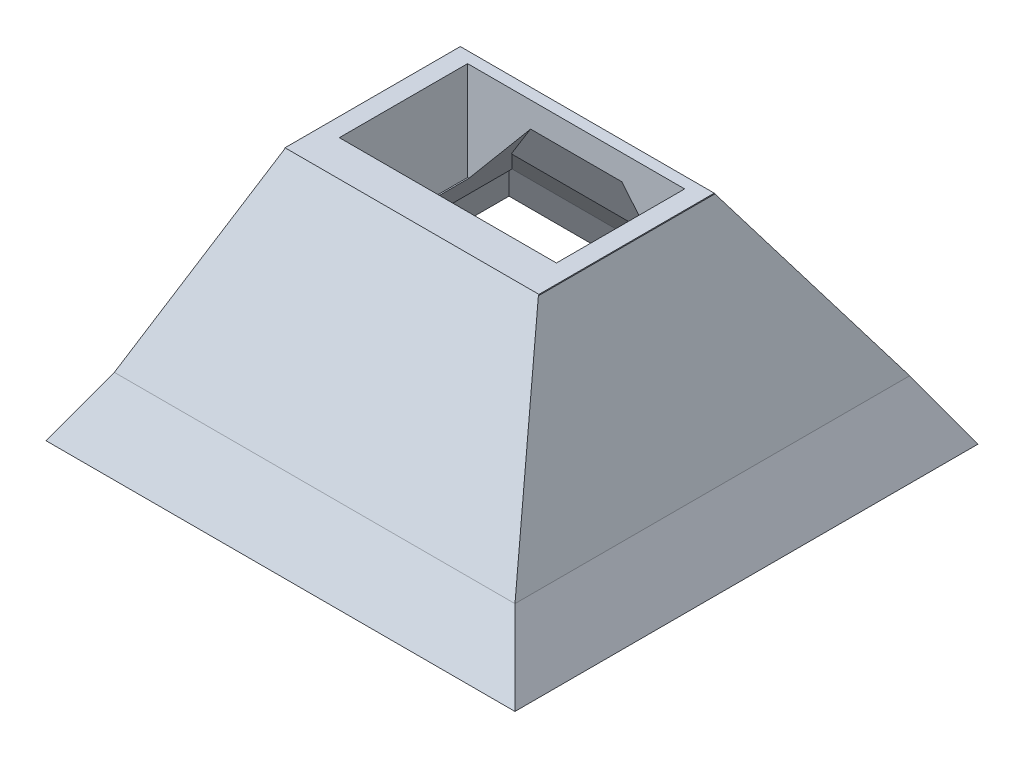
from build123d import *
from OCP.BRepFilletAPI import BRepFilletAPI_MakeChamfer

# Parameters (mm, degrees)
SKETCH1_W               = 40
SKETCH1_H               = 40
BOSS_EXTRUDE1_DEPTH     = 8.5
BOSS_EXTRUDE1_TAPER     = 40
SKETCH2_W               = 36
SKETCH2_H               = 36
CUT_EXTRUDE1_DEPTH      = 15
CUT_EXTRUDE1_DRAFT      = -40
SKETCH4_W               = 25.73530627
SKETCH4_H               = 25.73530627
BOSS_EXTRUDE3_DEPTH     = 10
SKETCH5_W               = 22
SKETCH5_H               = 13
CUT_EXTRUDE2_DEPTH      = 31.000000133
CHAMFER2_SIZE           = 12
CHAMFER2_SIZE_2         = 9.89892863
CUT_EXTRUDE3_DEPTH      = 35.154586706
CUT_EXTRUDE3_DEPTH_BACK = 35.154586706
CHAMFER3_SIZE           = 4.3
CHAMFER3_SIZE2          = 7.447818473
CUT_EXTRUDE4_DEPTH      = 35.154586706
CUT_EXTRUDE4_DEPTH_BACK = 35.154586706
SKETCH9_W               = 40.602605658
SKETCH9_H               = 40
BOSS_EXTRUDE4_DEPTH     = 6
BOSS_EXTRUDE4_DRAFT     = -30
SKETCH10_W              = 36.602605658
SKETCH10_H              = 36
CUT_EXTRUDE5_DEPTH      = 10
CUT_EXTRUDE5_DRAFT      = 30


with BuildPart() as part:
    # Sketch1 → Boss-Extrude1 (new body)
    with BuildSketch(Plane(origin=(0, 0, 0), x_dir=(1, 0, 0), z_dir=(0, 1, 0))):
        Rectangle(SKETCH1_W, SKETCH1_H)
    extrude(amount=BOSS_EXTRUDE1_DEPTH, taper=BOSS_EXTRUDE1_TAPER)


with BuildPart() as cut_extrude1_tool:
    # Sketch2 → Cut-Extrude1 (with draft: the straight prism first)
    with BuildSketch(Plane.XZ):
        Rectangle(SKETCH2_W, SKETCH2_H)
    extrude(amount=-CUT_EXTRUDE1_DEPTH)
    # Cut-Extrude1: the draft: its side faces are tilted about the plane it starts from
    cut_extrude1_sides = [cut_extrude1_tool.faces().sort_by_distance(p)[0] for p in [
        (0, 7.5, -18),
        (18, 7.5, 0),
        (0, 7.5, 18),
        (-18, 7.5, 0),
    ]]
    draft(cut_extrude1_sides, Plane.XZ, CUT_EXTRUDE1_DRAFT)


with BuildPart() as part_1:
    add(part.part)

    # Cut-Extrude1: cut by cut_extrude1_tool
    add(cut_extrude1_tool.part, mode=Mode.SUBTRACT)

    # Sketch4 → Boss-Extrude3 (add)
    with BuildSketch(Plane(origin=(0, 8.5, 0), x_dir=(1, 0, 0), z_dir=(0, 1, 0))):
        Rectangle(SKETCH4_W, SKETCH4_H)
    extrude(amount=BOSS_EXTRUDE3_DEPTH)

    # Sketch5 → Cut-Extrude2 (cut, through all)
    with BuildSketch(Plane.XZ.offset(-8.5)):
        Rectangle(SKETCH5_W, SKETCH5_H)
    extrude(amount=-CUT_EXTRUDE2_DEPTH, mode=Mode.SUBTRACT)

    # Chamfer2
    # the kernel refuses this chamfer: 12, 9.89892863 mm, written as the material it adds along each edge
    with BuildSketch(Plane(origin=(12.867653135, 8.5, 44.011128682), x_dir=(0.6427876096865404, -0.7660444431189772, 0), z_dir=(0, 0, -1))) as chamfer2_piece_1_section:
        Polygon((CHAMFER2_SIZE, 0), (-CHAMFER2_SIZE_2 * 0.766044443108, -CHAMFER2_SIZE_2 * 0.642787609677), (0, 0), align=None)
    chamfer2_piece_1 = extrude(amount=88.022257365, mode=Mode.PRIVATE)
    chamfer2_piece_1 = split(chamfer2_piece_1, bisect_by=Plane(origin=(12.867653135, 0, 44.011128682), z_dir=(0, 1, 0)), keep=Keep.TOP, mode=Mode.PRIVATE)
    chamfer2_piece_1 = split(chamfer2_piece_1, bisect_by=Plane(origin=(12.867653135, -0.927920344, 20.676206983), z_dir=(0, -0.37460659341591307, -0.9271838545667871)), keep=Keep.TOP, mode=Mode.PRIVATE)
    chamfer2_piece_1 = split(chamfer2_piece_1, bisect_by=Plane(origin=(12.867653135, 29.644778588, -8.32403482), z_dir=(0, -0.37460659341591274, 0.9271838545667872)), keep=Keep.TOP, mode=Mode.PRIVATE)
    add(chamfer2_piece_1)
    with BuildSketch(Plane(origin=(-12.867653135, 8.5, -44.011128682), x_dir=(-0.6427876096865406, -0.766044443118977, 0), z_dir=(0, 0, 1))) as chamfer2_piece_2_section:
        Polygon((CHAMFER2_SIZE, 0), (-CHAMFER2_SIZE_2 * 0.766044443108, -CHAMFER2_SIZE_2 * 0.642787609677), (0, 0), align=None)
    chamfer2_piece_2 = extrude(amount=88.022257365, mode=Mode.PRIVATE)
    chamfer2_piece_2 = split(chamfer2_piece_2, bisect_by=Plane(origin=(-12.867653135, 0, -44.011128682), z_dir=(0, 1, 0)), keep=Keep.TOP, mode=Mode.PRIVATE)
    chamfer2_piece_2 = split(chamfer2_piece_2, bisect_by=Plane(origin=(-12.867653135, -0.927920344, -20.676206983), z_dir=(0, -0.37460659341591274, 0.9271838545667872)), keep=Keep.TOP, mode=Mode.PRIVATE)
    chamfer2_piece_2 = split(chamfer2_piece_2, bisect_by=Plane(origin=(-12.867653135, 29.644778588, 8.32403482), z_dir=(0, -0.37460659341591307, -0.9271838545667871)), keep=Keep.TOP, mode=Mode.PRIVATE)
    add(chamfer2_piece_2)
    with BuildSketch(Plane(origin=(-44.011128682, 8.5, 12.867653135), x_dir=(0, -0.766044443118977, 0.6427876096865405), z_dir=(1, 0, 0))) as chamfer2_piece_3_section:
        Polygon((CHAMFER2_SIZE, 0), (-CHAMFER2_SIZE_2 * 0.766044443108, -CHAMFER2_SIZE_2 * 0.642787609677), (0, 0), align=None)
    chamfer2_piece_3 = extrude(amount=88.022257365, mode=Mode.PRIVATE)
    chamfer2_piece_3 = split(chamfer2_piece_3, bisect_by=Plane(origin=(-44.011128682, 0, 12.867653135), z_dir=(0, 1, 0)), keep=Keep.TOP, mode=Mode.PRIVATE)
    chamfer2_piece_3 = split(chamfer2_piece_3, bisect_by=Plane(origin=(-20.676206983, -0.927920344, 12.867653135), z_dir=(0.927183854566787, -0.37460659341591307, 0)), keep=Keep.TOP, mode=Mode.PRIVATE)
    chamfer2_piece_3 = split(chamfer2_piece_3, bisect_by=Plane(origin=(8.32403482, 29.644778588, 12.867653135), z_dir=(-0.9271838545667872, -0.37460659341591274, 0)), keep=Keep.TOP, mode=Mode.PRIVATE)
    add(chamfer2_piece_3)
    with BuildSketch(Plane(origin=(44.011128682, 8.5, -12.867653135), x_dir=(0, -0.766044443118977, -0.6427876096865405), z_dir=(-1, 0, 0))) as chamfer2_piece_4_section:
        Polygon((CHAMFER2_SIZE, 0), (-CHAMFER2_SIZE_2 * 0.766044443108, -CHAMFER2_SIZE_2 * 0.642787609677), (0, 0), align=None)
    chamfer2_piece_4 = extrude(amount=88.022257365, mode=Mode.PRIVATE)
    chamfer2_piece_4 = split(chamfer2_piece_4, bisect_by=Plane(origin=(44.011128682, 0, -12.867653135), z_dir=(0, 1, 0)), keep=Keep.TOP, mode=Mode.PRIVATE)
    chamfer2_piece_4 = split(chamfer2_piece_4, bisect_by=Plane(origin=(-8.32403482, 29.644778588, -12.867653135), z_dir=(0.927183854566787, -0.37460659341591307, 0)), keep=Keep.TOP, mode=Mode.PRIVATE)
    chamfer2_piece_4 = split(chamfer2_piece_4, bisect_by=Plane(origin=(20.676206983, -0.927920344, -12.867653135), z_dir=(-0.9271838545667872, -0.37460659341591274, 0)), keep=Keep.TOP, mode=Mode.PRIVATE)
    add(chamfer2_piece_4)

    # Sketch7 → Cut-Extrude3 (cut, two sides: drawn at the far end of the back side and taken through both)
    with BuildSketch(Plane(origin=(0, 0, 0), x_dir=(0, 0, -1), z_dir=(1, 0, 0)).offset(-CUT_EXTRUDE3_DEPTH_BACK)):
        Polygon((-20, 0), (-24.78585356, 0), (-24.78585356, 18.532984169), (-10.14, 18.5), align=None)
    extrude(amount=CUT_EXTRUDE3_DEPTH + CUT_EXTRUDE3_DEPTH_BACK, mode=Mode.SUBTRACT)

    # Chamfer3: one chamfer whose edges measure the first distance from different faces: ONE call of the kernel's chamfer builder (chamfer() names one face for all edges)
    chamfer3_edges_1 = [part_1.edges().sort_by_distance(p)[0] for p in [
        (0, 8.5, 6.5),
    ]]
    chamfer3_side_1 = [part_1.faces().sort_by_distance(p)[0] for p in [
        (0, 8.5, 8.683826567),
    ]]
    chamfer3_edges_2 = [part_1.edges().sort_by_distance(p)[0] for p in [
        (0, 8.5, -6.5),
    ]]
    chamfer3_side_2 = [part_1.faces().sort_by_distance(p)[0] for p in [
        (0, 8.5, -8.683826567),
    ]]
    chamfer3 = BRepFilletAPI_MakeChamfer(part_1.part.solid().wrapped)
    for e in chamfer3_edges_1:
        chamfer3.Add(CHAMFER3_SIZE, CHAMFER3_SIZE2, e.wrapped, chamfer3_side_1[0].wrapped)  # the first distance lies on this face
    for e in chamfer3_edges_2:
        chamfer3.Add(CHAMFER3_SIZE, CHAMFER3_SIZE2, e.wrapped, chamfer3_side_2[0].wrapped)  # the first distance lies on this face
    add(Compound.cast(chamfer3.Shape()), mode=Mode.REPLACE)

    # Sketch8 → Cut-Extrude4 (cut, two sides: drawn at the far end of the back side and taken through both)
    with BuildSketch(Plane(origin=(0, 0, 0), x_dir=(0, 0, -1), z_dir=(1, 0, 0)).offset(-CUT_EXTRUDE4_DEPTH_BACK)):
        Polygon((7.63, 18.5), (12.867653135, 18.5), (21.160182577, 0), (20, 0), align=None)
    extrude(amount=CUT_EXTRUDE4_DEPTH + CUT_EXTRUDE4_DEPTH_BACK, mode=Mode.SUBTRACT)


with BuildPart() as boss_extrude4_tool:
    # Sketch9 → Boss-Extrude4 (with draft: the straight prism first)
    with BuildSketch(Plane.XZ):
        Rectangle(SKETCH9_W, SKETCH9_H)
    extrude(amount=BOSS_EXTRUDE4_DEPTH)
    # Boss-Extrude4: the draft: its side faces are tilted about the plane it starts from
    boss_extrude4_sides = [boss_extrude4_tool.faces().sort_by_distance(p)[0] for p in [
        (0, -3, -20),
        (20.301302829, -3, 0),
        (0, -3, 20),
        (-20.301302829, -3, 0),
    ]]
    draft(boss_extrude4_sides, Plane.XZ, BOSS_EXTRUDE4_DRAFT)


with BuildPart() as part_2:
    add(part_1.part)

    # Boss-Extrude4: add boss_extrude4_tool
    add(boss_extrude4_tool.part)


with BuildPart() as cut_extrude5_tool:
    # Sketch10 → Cut-Extrude5 (with draft: the straight prism first)
    with BuildSketch(Plane(origin=(0, 0, 0), x_dir=(1, 0, 0), z_dir=(0, 1, 0))):
        Rectangle(SKETCH10_W, SKETCH10_H)
    extrude(amount=-CUT_EXTRUDE5_DEPTH)
    # Cut-Extrude5: the draft: its side faces are tilted about the plane it starts from
    cut_extrude5_sides = [cut_extrude5_tool.faces().sort_by_distance(p)[0] for p in [
        (0, -5, 18),
        (18.301302829, -5, 0),
        (0, -5, -18),
        (-18.301302829, -5, 0),
    ]]
    draft(cut_extrude5_sides, Plane(origin=(0, 0, 0), x_dir=(1, 0, 0), z_dir=(0, 1, 0)), CUT_EXTRUDE5_DRAFT)


with BuildPart() as part_3:
    add(part_2.part)

    # Cut-Extrude5: cut by cut_extrude5_tool
    add(cut_extrude5_tool.part, mode=Mode.SUBTRACT)


solid = part_3.part
